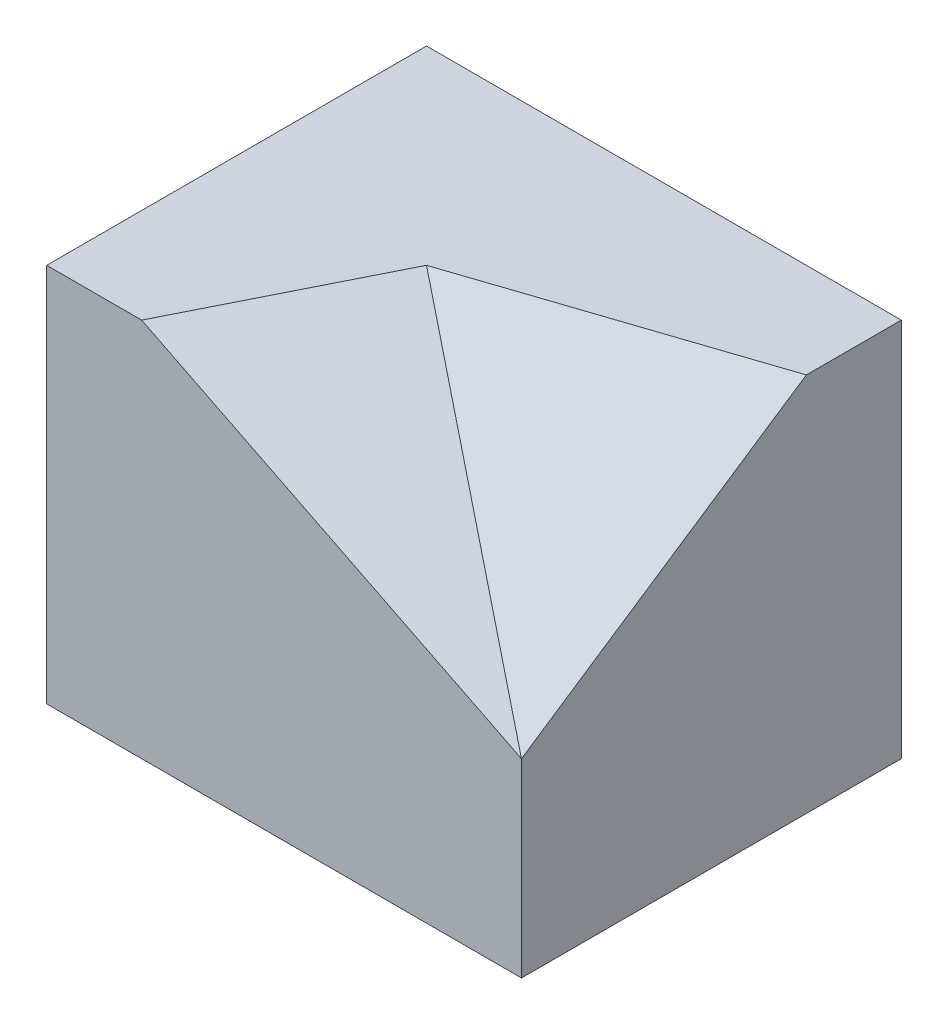
from build123d import *

# Parameters (mm, degrees)
SKETCH1_W           = 50
SKETCH1_H           = 40
BOSS_EXTRUDE1_DEPTH = 40
CUT_LOFT1_START     = -23.040884378
CUT_LOFT1_DEPTH     = 41.231056256


# Read off the part's stored shape, not the designer's step: Cut-Loft1
with BuildPart() as part:
    # Sketch1 → Boss-Extrude1 (new body)
    with BuildSketch(Plane(origin=(0, 0, 0), x_dir=(1, 0, 0), z_dir=(0, 1, 0))):
        Rectangle(SKETCH1_W, SKETCH1_H)
    extrude(amount=BOSS_EXTRUDE1_DEPTH)

    # Cut-Loft1 outline → Cut-Loft1 (cut)
    with BuildSketch(Plane(origin=(0, 0, 0), x_dir=(0.6859943405700354, 0.5144957554275265, -0.5144957554275265), z_dir=(0.7276068751089988, -0.4850712500726662, 0.4850712500726662)).offset(CUT_LOFT1_START)):
        Polygon((-1.908261965, 44), (0, 42.426406871), (17.149858514, 28.284271247), (42.874646286, 21.213203436), (44, 20.903873287), (44, 44), align=None)
    extrude(amount=CUT_LOFT1_DEPTH, mode=Mode.SUBTRACT)


solid = part.part
